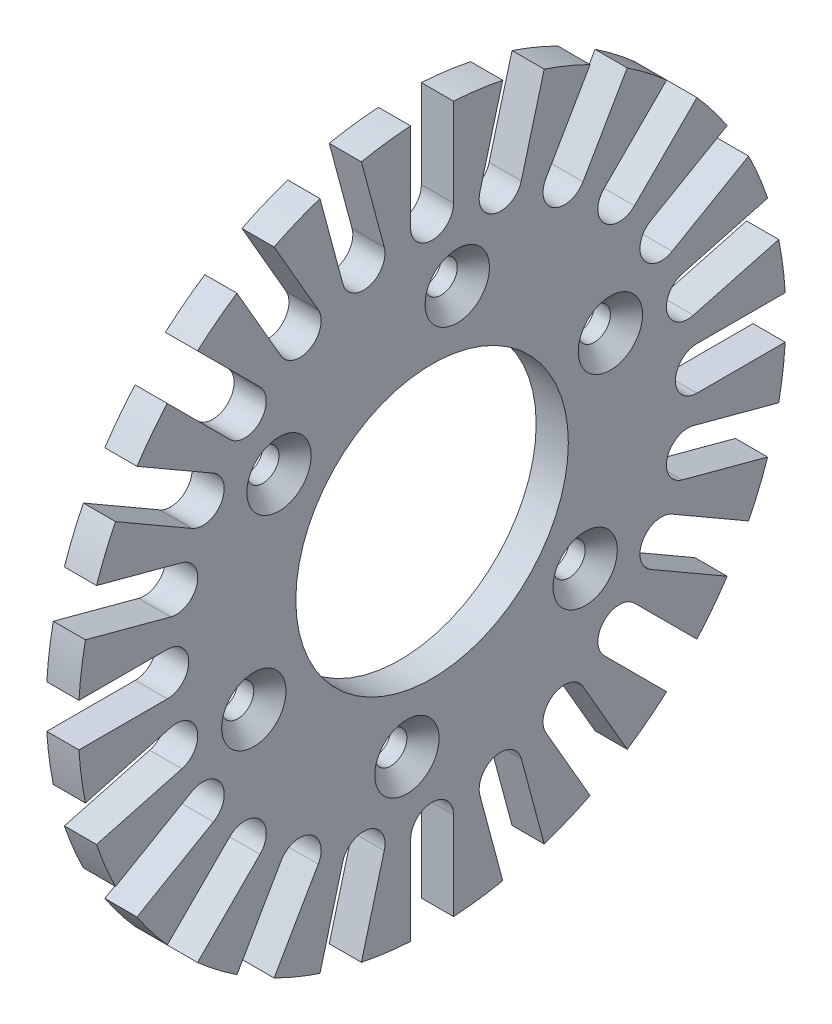
from build123d import *

# Parameters (mm, degrees)
SKETCH1_R                    = 33
BOSS_EXTRUDE1_DEPTH          = 3
CUT_EXTRUDE2_REACH           = 48.765
SKETCH3_R                    = 12.71
CUT_EXTRUDE3_REACH           = 48.765
CIRPATTERN2_COUNT            = 24
CUT_EXTRUDE1_REACH           = 48.68
SKETCH2_R                    = 1.5
CHAMFER1_SIZE                = 1.5
CIRPATTERN1_COUNT            = 6
CHAMFER1_OF_CIRPATTERN1_SIZE = 1.5


with BuildPart() as part:
    # Sketch1 → Boss-Extrude1 (new body)
    with BuildSketch(Plane(origin=(0, 0, 0), x_dir=(0, 0, -1), z_dir=(1, 0, 0))):
        Circle(SKETCH1_R)
    extrude(amount=BOSS_EXTRUDE1_DEPTH)

    # Sketch3 → Cut-Extrude2 (cut, up to next)
    with BuildSketch(Plane(origin=(3, 0, 0), x_dir=(0, 0, -1), z_dir=(1, 0, 0)), mode=Mode.PRIVATE) as cut_extrude2_sk1:
        Circle(SKETCH3_R)
    cut_extrude2_tool1 = extrude(cut_extrude2_sk1.sketch, amount=-CUT_EXTRUDE2_REACH, mode=Mode.PRIVATE) & part.part
    add(cut_extrude2_tool1.solids().sort_by_distance((3, 0, 0))[0], mode=Mode.SUBTRACT)

    # Sketch4 → Cut-Extrude3 (cut, up to next)
    with BuildSketch(Plane(origin=(3, 0, 0), x_dir=(0, 0, -1), z_dir=(1, 0, 0)), mode=Mode.PRIVATE) as cut_extrude3_sk1:
        with BuildLine():
            Line((-2, 33), (-2, 24.7))
            ThreePointArc((-2, 24.7), (0, 22.7), (2, 24.7))
            Line((2, 24.7), (2, 33))
            Line((2, 33), (-2, 33))
        make_face()
    cut_extrude3_tool1 = extrude(cut_extrude3_sk1.sketch, amount=-CUT_EXTRUDE3_REACH, mode=Mode.PRIVATE) & part.part
    cut_extrude3 = cut_extrude3_tool1.solids().sort_by_distance((3, 28.054508, 0))[0]
    add(cut_extrude3, mode=Mode.SUBTRACT)

    # CirPattern2: Cut-Extrude3 ×24 about axis
    cirpattern2_axis = Axis((3, 0, 0), (1, 0, 0))
    for i in range(1, CIRPATTERN2_COUNT):
        add(cut_extrude3.rotate(cirpattern2_axis, i * 360 / CIRPATTERN2_COUNT), mode=Mode.SUBTRACT)

    # Sketch2 → Cut-Extrude1 (cut, up to next)
    with BuildSketch(Plane(origin=(3, 0, 0), x_dir=(0, 0, -1), z_dir=(1, 0, 0)), mode=Mode.PRIVATE) as cut_extrude1_sk1:
        with Locations((2.34947146, 17.846007505)):
            Circle(SKETCH2_R)
    cut_extrude1_tool1 = extrude(cut_extrude1_sk1.sketch, amount=-CUT_EXTRUDE1_REACH, mode=Mode.PRIVATE) & part.part
    cut_extrude1 = cut_extrude1_tool1.solids().sort_by_distance((3, 17.846008, -2.349471))[0]
    add(cut_extrude1, mode=Mode.SUBTRACT)

    # Chamfer1
    chamfer1_edges = [part.edges().sort_by_distance(p)[0] for p in [
        (3, 17.846007505, -0.84947146),
    ]]
    chamfer(chamfer1_edges, length=CHAMFER1_SIZE)

    # CirPattern1: Cut-Extrude1 ×6 about axis
    cirpattern1_axis = Axis((3, 0, 0), (1, 0, 0))
    for i in range(1, CIRPATTERN1_COUNT):
        add(cut_extrude1.rotate(cirpattern1_axis, i * 360 / CIRPATTERN1_COUNT), mode=Mode.SUBTRACT)

    # Chamfer1 of CirPattern1
    chamfer1_of_cirpattern1_edges = [part.edges().sort_by_distance(p)[0] for p in [
        (3, 9.658667616, 15.030360125),
        (3, -8.187339888, 15.879831585),
        (3, -17.846007505, 0.84947146),
        (3, -9.658667616, -15.030360125),
        (3, 8.187339888, -15.879831585),
    ]]
    chamfer(chamfer1_of_cirpattern1_edges, length=CHAMFER1_OF_CIRPATTERN1_SIZE)


solid = part.part
